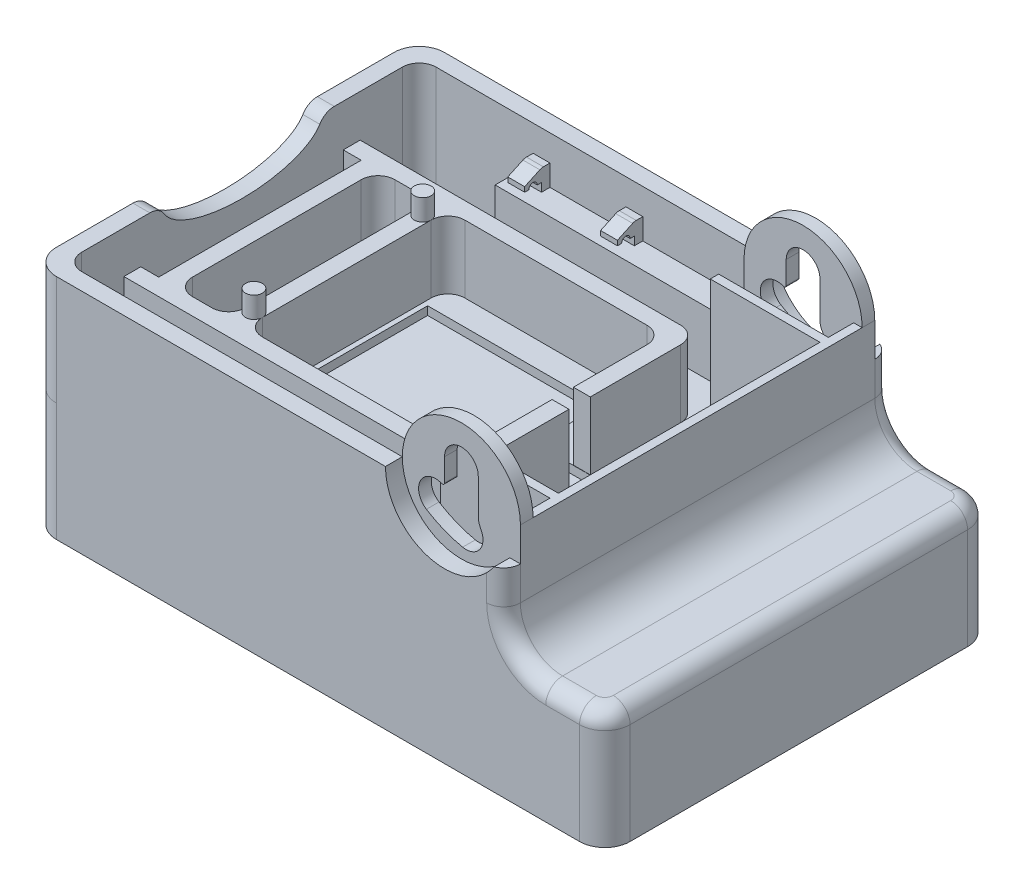
from build123d import *

# Parameters (mm, degrees)
SKETCH1_W                = 68
SKETCH1_H                = 46
BOSS_EXTRUDE1_DEPTH      = 14
SKETCH2_W                = 64
SKETCH2_H                = 42
CUT_EXTRUDE1_DEPTH       = 12
FILLET3_R                = 3
SKETCH16_W               = 56
SKETCH16_H               = 46
BOSS_EXTRUDE5_DEPTH      = 13
FILLET4_R                = 3
SKETCH17_W               = 40
SKETCH17_H               = 42
CUT_EXTRUDE2_DEPTH       = 13
SKETCH18_W               = 13
SKETCH18_H               = 39
CUT_EXTRUDE3_DEPTH       = 13
SKETCH19_W               = 2
SKETCH19_H               = 5
CUT_EXTRUDE4_DEPTH       = 13
SKETCH20_W               = 18
SKETCH20_H               = 2.5
CUT_EXTRUDE5_DEPTH       = 1
SKETCH21_W               = 20.5
SKETCH21_H               = 15.5
CUT_EXTRUDE6_DEPTH       = 1
SKETCH22_R               = 7
CUT_EXTRUDE7_DEPTH       = 2
SKETCH23_R               = 7
BOSS_EXTRUDE6_DEPTH      = 1.5
SKETCH24_RX              = 9.5
SKETCH24_RY              = 4
CUT_EXTRUDE8_DEPTH       = 2
FILLET5_R                = 2
FILLET6_START            = -35
FILLET6_DEPTH            = 43
CUT_EXTRUDE9_DEPTH       = 1.5
CUT_EXTRUDE10_DEPTH      = 1.5
SKETCH40_W               = 2
SKETCH40_H               = 4
CUT_EXTRUDE11_DEPTH      = 10
SKETCH38_W               = 13
SKETCH38_H               = 1
BOSS_EXTRUDE7_DEPTH      = 13
SKETCH47_W               = 40
SKETCH47_H               = 2
BOSS_EXTRUDE8_DEPTH      = 8
SKETCH48_W               = 2
SKETCH48_H               = 24
SKETCH48_H_2             = 10.721767088
SKETCH48_H_3             = 10.75
BOSS_EXTRUDE9_DEPTH      = 8
FILLET7_R                = 2
FILLET8_R                = 2
FILLET10_R               = 2
FILLET11_R               = 2
FILLET13_R               = 5
FINAL_ASSEMBLY_START     = 17
FINAL_ASSEMBLY_OUTLINE_W = 3.7
FINAL_ASSEMBLY_OUTLINE_H = 0.7
FINAL_ASSEMBLY_DEPTH     = 4
SNAP_START               = -12.5
SNAP_GROOVE2_OUTLINE_W   = 4
SNAP_GROOVE2_OUTLINE_H   = 0.7
SNAP_GROOVE2_DEPTH       = 3.7
SKETCH46_R               = 1
BOSS_EXTRUDE10_DEPTH     = 10.5
MIRROR13_START           = 7
MIRROR13_OUTLINE_R       = 1
MIRROR13_DEPTH           = 3.5
SKETCH49_W               = 28
SKETCH49_H               = 3
BOSS_EXTRUDE11_DEPTH     = 7.4
SKETCH50_W               = 2
SKETCH50_H               = 3
BOSS_EXTRUDE12_DEPTH     = 2.5
SKETCH51_W               = 2
SKETCH51_H               = 1
CUT_EXTRUDE12_DEPTH      = 2.5
SKETCH53_R               = 0.5
CUT_EXTRUDE13_DEPTH      = 2.5
CUT_EXTRUDE14_DEPTH      = 2.5
FILLET14_R               = 1
FILLET14_OF_MIRROR16_R   = 1
MIRROR17_START           = -18.5
MIRROR17_DEPTH           = 2
MIRROR17_START_2         = -7.5
MIRROR17_2_DEPTH         = 2
FILLET15_R               = 0.25
FILLET16_R               = 2.5
FILLET17_R               = 2
FILLET18_R               = 1.75
FILLET19_R               = 0.25
SKETCH59_W               = 53.5
SKETCH59_H               = 27
BOSS_EXTRUDE13_DEPTH     = 6
SKETCH57_W               = 52
SKETCH57_H               = 24
CUT_EXTRUDE15_DEPTH      = 6
SKETCH60_W               = 1.5
SKETCH60_H               = 5.001433763
CUT_EXTRUDE16_DEPTH      = 6
FILLET20_R               = 1


with BuildPart() as part:
    # Sketch1 → Boss-Extrude1 (new body)
    with BuildSketch(Plane(origin=(0, 0, 0), x_dir=(1, 0, 0), z_dir=(0, 1, 0))):
        Rectangle(SKETCH1_W, SKETCH1_H)
    extrude(amount=-BOSS_EXTRUDE1_DEPTH)

    # Sketch2 → Cut-Extrude1 (cut)
    with BuildSketch(Plane.XZ.offset(14)):
        Rectangle(SKETCH2_W, SKETCH2_H)
    extrude(amount=-CUT_EXTRUDE1_DEPTH, mode=Mode.SUBTRACT)

    # Fillet3
    fillet3_edges = [part.edges().sort_by_distance(p)[0] for p in [
        (-34, -7, -23),
        (34, -7, -23),
        (34, -7, 23),
        (-34, -7, 23),
    ]]
    fillet(fillet3_edges, radius=FILLET3_R)

    # Sketch16 → Boss-Extrude5 (add)
    with BuildSketch(Plane(origin=(0, 0, 0), x_dir=(1, 0, 0), z_dir=(0, 1, 0))):
        with Locations((-6, 0)):
            Rectangle(SKETCH16_W, SKETCH16_H)
    extrude(amount=BOSS_EXTRUDE5_DEPTH)

    # Fillet4
    fillet4_edges = [part.edges().sort_by_distance(p)[0] for p in [
        (-34, 6.5, 23),
        (-34, 6.5, -23),
    ]]
    fillet(fillet4_edges, radius=FILLET4_R)

    # Sketch17 → Cut-Extrude2 (cut)
    with BuildSketch(Plane(origin=(0, 13, 0), x_dir=(1, 0, 0), z_dir=(0, 1, 0))):
        with Locations((-12, 0)):
            Rectangle(SKETCH17_W, SKETCH17_H)
    extrude(amount=-CUT_EXTRUDE2_DEPTH, mode=Mode.SUBTRACT)

    # Sketch18 → Cut-Extrude3 (cut)
    with BuildSketch(Plane(origin=(0, 13, 0), x_dir=(1, 0, 0), z_dir=(0, 1, 0))):
        with Locations((14.5, 0)):
            Rectangle(SKETCH18_W, SKETCH18_H)
    extrude(amount=-CUT_EXTRUDE3_DEPTH, mode=Mode.SUBTRACT)

    # Sketch19 → Cut-Extrude4 (cut)
    with BuildSketch(Plane(origin=(0, 0, 0), x_dir=(1, 0, 0), z_dir=(0, 1, 0))):
        with Locations((20, 0)):
            Rectangle(SKETCH19_W, SKETCH19_H)
    extrude(amount=-CUT_EXTRUDE4_DEPTH, mode=Mode.SUBTRACT)

    # Sketch20 → Cut-Extrude5 (cut)
    with BuildSketch(Plane(origin=(0, 0, 0), x_dir=(1, 0, 0), z_dir=(0, 1, 0))):
        with Locations((10.288842332, 0)):
            Rectangle(SKETCH20_W, SKETCH20_H)
    extrude(amount=-CUT_EXTRUDE5_DEPTH, mode=Mode.SUBTRACT)

    # Sketch21 → Cut-Extrude6 (cut)
    with BuildSketch(Plane(origin=(0, 0, 0), x_dir=(1, 0, 0), z_dir=(0, 1, 0))):
        with Locations((-8.75, 1.25)):
            Rectangle(SKETCH21_W, SKETCH21_H)
    extrude(amount=-CUT_EXTRUDE6_DEPTH, mode=Mode.SUBTRACT)

    # Sketch22 → Cut-Extrude7 (cut)
    with BuildSketch(Plane.XY.offset(23)):
        with Locations((15, 13)):
            Circle(SKETCH22_R)
    cut_extrude7 = extrude(amount=-CUT_EXTRUDE7_DEPTH, mode=Mode.SUBTRACT)

    # Mirror4: Cut-Extrude7 across plane
    add(cut_extrude7.mirror(Plane.XY), mode=Mode.SUBTRACT)

    # Sketch23 → Boss-Extrude6 (add)
    with BuildSketch(Plane.XY.offset(21)):
        with Locations((15, 13)):
            Circle(SKETCH23_R)
    boss_extrude6 = extrude(amount=-BOSS_EXTRUDE6_DEPTH)

    # Sketch24 → Cut-Extrude8 (cut)
    with BuildSketch(Plane.ZY.offset(34)):
        with Locations(Location((0, 13), (0, 0, 0))):
            Ellipse(SKETCH24_RX, SKETCH24_RY)
    extrude(amount=-CUT_EXTRUDE8_DEPTH, mode=Mode.SUBTRACT)

    # Fillet5
    fillet5_edges = [part.edges().sort_by_distance(p)[0] for p in [
        (-33, 13, -9.5),
    ]]
    fillet(fillet5_edges, radius=FILLET5_R)

    # Fillet6: read off the stored shape, not the designer's step
    # Fillet6 outline → Fillet6 (cut)
    with BuildSketch(Plane.YZ.offset(FILLET6_START)):
        with BuildLine():
            Line((13, 9.5), (13, 10.930836388))
            ThreePointArc((13, 10.930836388), (12.739266462, 9.943439722), (12.025047824, 9.213490483))
            add(Edge.make_bspline(
                [(12.025047824, 9.213490483), (12.505060497, 9.5), (13, 9.5)],
                knots=[6.024810946, 6.024810946, 6.024810946, 6.283185307, 6.283185307, 6.283185307], degree=2, weights=[0.926474215, 0.955250488, 1]))
        make_face()
    extrude(amount=FILLET6_DEPTH, mode=Mode.SUBTRACT)

    # Sketch29 → Cut-Extrude9 (cut)
    with BuildSketch(Plane.XY.offset(21)):
        with BuildLine():
            Line((13, 15.5), (13, 10.5))
            Line((13, 10.5), (17, 10.5))
            Line((17, 10.5), (17, 15.5))
            ThreePointArc((17, 15.5), (15, 17.5), (13, 15.5))
        make_face()
    cut_extrude9 = extrude(amount=-CUT_EXTRUDE9_DEPTH, mode=Mode.SUBTRACT)

    # Sketch36 → Cut-Extrude10 (cut)
    with BuildSketch(Plane.XY.offset(21)):
        with BuildLine():
            ThreePointArc((10.855655382, 9.036561561), (12.925281353, 7.971125214), (15.152727771, 7.295115801))
            ThreePointArc((15.152727771, 7.295115801), (17.516862125, 8.847813054), (15.964164872, 11.211947407))
            ThreePointArc((15.964164872, 11.211947407), (14.42764935, 11.678265675), (13, 12.413214661))
            ThreePointArc((13, 12.413214661), (10.239501141, 11.79706042), (10.855655382, 9.036561561))
        make_face()
    cut_extrude10 = extrude(amount=-CUT_EXTRUDE10_DEPTH, mode=Mode.SUBTRACT)

    # Mirror6: Boss-Extrude6 across plane
    add(boss_extrude6.mirror(Plane.XY))

    # Mirror8: Cut-Extrude9, Cut-Extrude10 across plane
    add(cut_extrude9.mirror(Plane.XY), mode=Mode.SUBTRACT)
    add(cut_extrude10.mirror(Plane.XY), mode=Mode.SUBTRACT)

    # Sketch40 → Cut-Extrude11 (cut)
    with BuildSketch(Plane(origin=(22, 0, 0), x_dir=(0, 0, -1), z_dir=(1, 0, 0))):
        with Locations((-22, 11)):
            Rectangle(SKETCH40_W, SKETCH40_H)
    cut_extrude11 = extrude(amount=-CUT_EXTRUDE11_DEPTH, mode=Mode.SUBTRACT)

    # Mirror9: Cut-Extrude11 across plane
    add(cut_extrude11.mirror(Plane.XY), mode=Mode.SUBTRACT)

    # Sketch38 → Boss-Extrude7 (add)
    with BuildSketch(Plane(origin=(0, 0, 0), x_dir=(1, 0, 0), z_dir=(0, 1, 0))):
        with Locations((14.5, 16)):
            Rectangle(SKETCH38_W, SKETCH38_H)
    boss_extrude7 = extrude(amount=BOSS_EXTRUDE7_DEPTH)

    # Mirror10: Boss-Extrude7 across plane
    add(boss_extrude7.mirror(Plane.XY))

    # Sketch47 → Boss-Extrude8 (add)
    with BuildSketch(Plane(origin=(0, 0, 0), x_dir=(1, 0, 0), z_dir=(0, 1, 0))):
        with Locations((-12, 13)):
            Rectangle(SKETCH47_W, SKETCH47_H)
        with Locations((-12, -13)):
            Rectangle(SKETCH47_W, SKETCH47_H)
    extrude(amount=BOSS_EXTRUDE8_DEPTH)

    # Sketch48 → Boss-Extrude9 (add)
    with BuildSketch(Plane(origin=(0, 0, 0), x_dir=(1, 0, 0), z_dir=(0, 1, 0))):
        with Locations((-28.876953075, 0)):
            Rectangle(SKETCH48_W, SKETCH48_H)
        with Locations((-20.587227556, 0)):
            Rectangle(SKETCH48_W, SKETCH48_H)
        with Locations((7, 6.639116456)):
            Rectangle(SKETCH48_W, SKETCH48_H_2)
        with Locations((7, -6.625)):
            Rectangle(SKETCH48_W, SKETCH48_H_3)
    extrude(amount=BOSS_EXTRUDE9_DEPTH)

    # Fillet7
    fillet7_edges = [part.edges().sort_by_distance(p)[0] for p in [
        (8, 4, -14),
        (8, 4, 14),
    ]]
    fillet(fillet7_edges, radius=FILLET7_R)

    # Fillet8
    fillet8_edges = [part.edges().sort_by_distance(p)[0] for p in [
        (-19.587227556, 4, 12),
        (-19.587227556, 4, -12),
        (6, 4, -12),
        (6, 4, 12),
    ]]
    fillet(fillet8_edges, radius=FILLET8_R)

    # Fillet10
    fillet10_edges = [part.edges().sort_by_distance(p)[0] for p in [
        (-27.876953075, 4, 12),
        (-27.876953075, 4, -12),
        (-21.587227556, 4, -12),
        (-21.587227556, 4, 12),
    ]]
    fillet(fillet10_edges, radius=FILLET10_R)

    # Fillet11
    fillet11_edges = [part.edges().sort_by_distance(p)[0] for p in [
        (-32, 6.5, 21),
        (-32, 6.5, -21),
    ]]
    fillet(fillet11_edges, radius=FILLET11_R)

    # Fillet13
    fillet13_edges = [part.edges().sort_by_distance(p)[0] for p in [
        (22, 0, 0),
    ]]
    fillet(fillet13_edges, radius=FILLET13_R)

    # final-assembly: read off the stored shape, not the designer's step
    # final-assembly outline → final-assembly (cut)
    with BuildSketch(Plane.YZ.offset(FINAL_ASSEMBLY_START)):
        with Locations((-10.65, -21.35)):
            Rectangle(FINAL_ASSEMBLY_OUTLINE_W, FINAL_ASSEMBLY_OUTLINE_H)
    final_assembly = extrude(amount=FINAL_ASSEMBLY_DEPTH, mode=Mode.SUBTRACT)

    # Snap Groove2: read off the stored shape, not the designer's step
    # Snap Groove2 outline → Snap Groove2 (cut)
    with BuildSketch(Plane(origin=(0, 0, 0), x_dir=(1, 0, 0), z_dir=(0, 1, 0)).offset(SNAP_START)):
        with Locations((-9, 21.35)):
            Rectangle(SNAP_GROOVE2_OUTLINE_W, SNAP_GROOVE2_OUTLINE_H)
    snap_groove2 = extrude(amount=SNAP_GROOVE2_DEPTH, mode=Mode.SUBTRACT)

    # Mirror12: final-assembly, Snap Groove2 across plane
    add(final_assembly.mirror(Plane.XY), mode=Mode.SUBTRACT)
    add(snap_groove2.mirror(Plane.XY), mode=Mode.SUBTRACT)

    # Sketch46 → Boss-Extrude10 (add)
    with BuildSketch(Plane(origin=(0, 0, 0), x_dir=(1, 0, 0), z_dir=(0, 1, 0))):
        with Locations(Location((-20.587227556, 10, 0), (0, 0, 179.99933837))):
            Circle(SKETCH46_R)
    extrude(amount=BOSS_EXTRUDE10_DEPTH)

    # Mirror13: read off the stored shape, not the designer's step
    # Mirror13 outline → Mirror13 (add)
    with BuildSketch(Plane(origin=(0, 0, 0), x_dir=(1, 0, 0), z_dir=(0, 1, 0)).offset(MIRROR13_START)):
        with Locations((-20.587227556, -10)):
            Circle(MIRROR13_OUTLINE_R)
    extrude(amount=MIRROR13_DEPTH)

    # Sketch49 → Boss-Extrude11 (add)
    with BuildSketch(Plane(origin=(0, 0, 0), x_dir=(1, 0, 0), z_dir=(0, 1, 0))):
        with Locations((-6, 19.5)):
            Rectangle(SKETCH49_W, SKETCH49_H)
    boss_extrude11 = extrude(amount=BOSS_EXTRUDE11_DEPTH)

    # Mirror14: Boss-Extrude11 across plane
    add(boss_extrude11.mirror(Plane.XY))

    # Sketch50 → Boss-Extrude12 (add)
    with BuildSketch(Plane(origin=(0, 7.4, 0), x_dir=(1, 0, 0), z_dir=(0, 1, 0))):
        with Locations((-17.5, 19.5)):
            Rectangle(SKETCH50_W, SKETCH50_H)
    boss_extrude12 = extrude(amount=BOSS_EXTRUDE12_DEPTH)

    # Sketch51 → Cut-Extrude12 (cut)
    with BuildSketch(Plane.ZY.offset(18.5)):
        with Locations((-19, 7.9)):
            Rectangle(SKETCH51_W, SKETCH51_H)
    cut_extrude12 = extrude(amount=-CUT_EXTRUDE12_DEPTH, mode=Mode.SUBTRACT)

    # Sketch53 → Cut-Extrude13 (cut)
    with BuildSketch(Plane.ZY.offset(18.5)):
        with Locations((-19, 8.4)):
            Circle(SKETCH53_R)
    cut_extrude13 = extrude(amount=-CUT_EXTRUDE13_DEPTH, mode=Mode.SUBTRACT)

    # Sketch54 → Cut-Extrude14 (cut)
    with BuildSketch(Plane.ZY.offset(18.5)):
        Polygon((-20, 9.9), (-18, 8.973286149), (-18, 9.9), align=None)
    cut_extrude14 = extrude(amount=-CUT_EXTRUDE14_DEPTH, mode=Mode.SUBTRACT)

    # Fillet14
    fillet14_edges = [part.edges().sort_by_distance(p)[0] for p in [
        (-17.5, 9.9, -20),
    ]]
    fillet(fillet14_edges, radius=FILLET14_R)

    # Mirror16: Boss-Extrude12, Cut-Extrude12, Cut-Extrude13, Cut-Extrude14 across plane
    add(boss_extrude12.mirror(Plane(origin=(-12, 0, 0), x_dir=(0, 0, 1), z_dir=(1, 0, 0))))
    add(cut_extrude12.mirror(Plane(origin=(-12, 0, 0), x_dir=(0, 0, 1), z_dir=(1, 0, 0))), mode=Mode.SUBTRACT)
    add(cut_extrude13.mirror(Plane(origin=(-12, 0, 0), x_dir=(0, 0, 1), z_dir=(1, 0, 0))), mode=Mode.SUBTRACT)
    add(cut_extrude14.mirror(Plane(origin=(-12, 0, 0), x_dir=(0, 0, 1), z_dir=(1, 0, 0))), mode=Mode.SUBTRACT)

    # Fillet14 of Mirror16
    fillet14_of_mirror16_edges = [part.edges().sort_by_distance(p)[0] for p in [
        (-6.5, 9.9, -20),
    ]]
    fillet(fillet14_of_mirror16_edges, radius=FILLET14_OF_MIRROR16_R)

    # Mirror17: read off the stored shape, not the designer's step
    # Mirror17 outline → Mirror17 (add)
    with BuildSketch(Plane.YZ.offset(MIRROR17_START)):
        with BuildLine():
            Line((8.4, 20), (8.4, 19.5))
            ThreePointArc((8.4, 19.5), (8.9, 19), (8.4, 18.5))
            Line((8.4, 18.5), (8.4, 18))
            Line((8.4, 18), (8.973286149, 18))
            Line((8.973286149, 18), (9.807330581, 19.800004242))
            ThreePointArc((9.807330581, 19.800004242), (9.876557879, 20.005167163), (9.9, 20.220422151))
            Line((9.9, 20.220422151), (9.9, 21))
            Line((9.9, 21), (7.4, 21))
            Line((7.4, 21), (7.4, 20))
            Line((7.4, 20), (8.4, 20))
        make_face()
    extrude(amount=MIRROR17_DEPTH)

    # Mirror17 2 outline → Mirror17 2 (add)
    with BuildSketch(Plane.YZ.offset(MIRROR17_START_2)):
        with BuildLine():
            Line((8.4, 20), (8.4, 19.5))
            ThreePointArc((8.4, 19.5), (8.9, 19), (8.4, 18.5))
            Line((8.4, 18.5), (8.4, 18))
            Line((8.4, 18), (8.973286149, 18))
            Line((8.973286149, 18), (9.807330581, 19.800004242))
            ThreePointArc((9.807330581, 19.800004242), (9.876557879, 20.005167163), (9.9, 20.220422151))
            Line((9.9, 20.220422151), (9.9, 21))
            Line((9.9, 21), (7.4, 21))
            Line((7.4, 21), (7.4, 20))
            Line((7.4, 20), (8.4, 20))
        make_face()
    extrude(amount=MIRROR17_2_DEPTH)

    # Fillet15
    fillet15_edges = [part.edges().sort_by_distance(p)[0] for p in [
        (13, 12.413214661, 20.25),
    ]]
    fillet(fillet15_edges, radius=FILLET15_R)

    # Fillet16
    fillet16_edges = [part.edges().sort_by_distance(p)[0] for p in [
        (17, 10.639865977, 20.25),
    ]]
    fillet(fillet16_edges, radius=FILLET16_R)

    # Fillet17
    fillet17_edges = [part.edges().sort_by_distance(p)[0] for p in [
        (22, 7, 23),
        (23.464466094, 1.464466094, 23),
        (29, 0, 23),
        (33.121320344, 0, 22.121320344),
        (22, 7, -23),
        (23.464466094, 1.464466094, -23),
        (29, 0, -23),
        (33.121320344, 0, -22.121320344),
        (34, 0, 0),
    ]]
    fillet(fillet17_edges, radius=FILLET17_R)

    # Fillet18
    fillet18_edges = [part.edges().sort_by_distance(p)[0] for p in [
        (17, 10.639865977, -20.25),
    ]]
    fillet(fillet18_edges, radius=FILLET18_R)

    # Fillet19
    fillet19_edges = [part.edges().sort_by_distance(p)[0] for p in [
        (13, 12.413214661, -20.25),
    ]]
    fillet(fillet19_edges, radius=FILLET19_R)

    # Sketch59 → Boss-Extrude13 (add)
    with BuildSketch(Plane(origin=(0, -2, 0), x_dir=(-1, 0, 0), z_dir=(0, -1, 0))):
        with Locations((5.25, 0)):
            Rectangle(SKETCH59_W, SKETCH59_H)
    extrude(amount=BOSS_EXTRUDE13_DEPTH)

    # Sketch57 → Cut-Extrude15 (cut)
    with BuildSketch(Plane.XZ.offset(2)):
        with Locations((-6, 0)):
            Rectangle(SKETCH57_W, SKETCH57_H)
    extrude(amount=CUT_EXTRUDE15_DEPTH, mode=Mode.SUBTRACT)

    # Sketch60 → Cut-Extrude16 (cut)
    with BuildSketch(Plane.XZ.offset(8)):
        with Locations((20.75, -0.000716882)):
            Rectangle(SKETCH60_W, SKETCH60_H)
    extrude(amount=-CUT_EXTRUDE16_DEPTH, mode=Mode.SUBTRACT)

    # Fillet20
    fillet20_edges = [part.edges().sort_by_distance(p)[0] for p in [
        (21.5, -5, -13.5),
        (21.5, -5, 13.5),
    ]]
    fillet(fillet20_edges, radius=FILLET20_R)


solid = part.part
